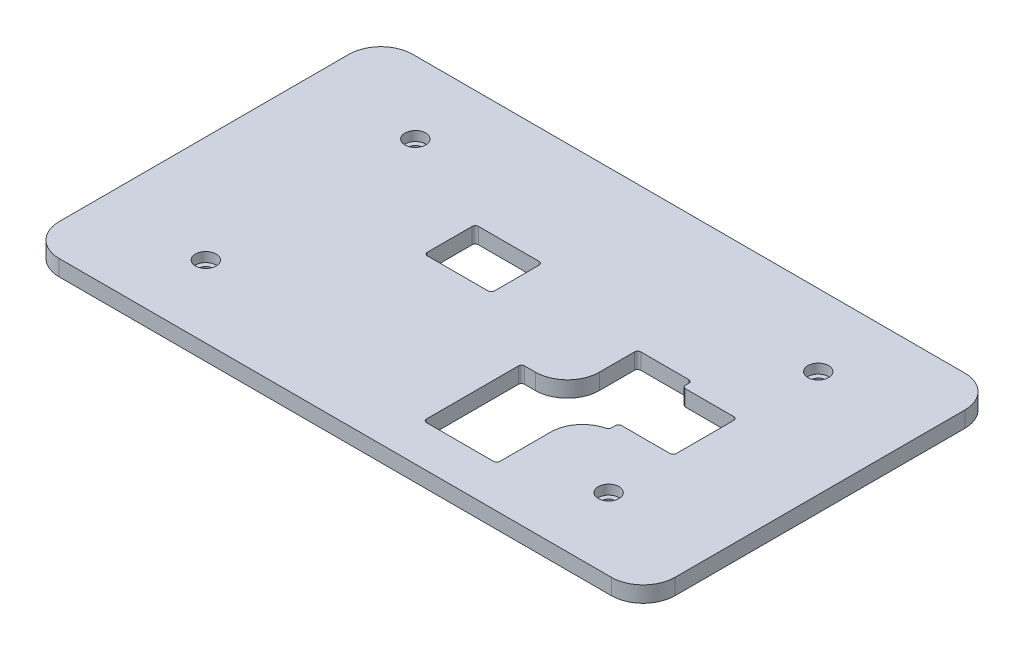
from build123d import *

# Parameters (mm, degrees)
SKETCH1_W                      = 192.96
SKETCH1_H                      = 110.76
BOSS_EXTRUDE1_DEPTH            = 5
CBORE_START                    = 2
CBORE_FOR_M3_SHCS1_OUTLINE_R   = 3.25
CBORE_FOR_M3_SHCS1_DEPTH       = 3
CBORE_FOR_M3_SHCS1_2_OUTLINE_R = 1.8
CBORE_FOR_M3_SHCS1_2_DEPTH     = 2
SKETCH9_W                      = 21
SKETCH9_H                      = 16
CUT_EXTRUDE1_DEPTH             = 112.356790543
FILLET1_R                      = 10
FILLET2_R                      = 10
FILLET3_R                      = 1


# Read off the part's stored shape, not the designer's step: CBORE for M3 SHCS1
with BuildPart() as part:
    # Sketch1 → Boss-Extrude1 (new body)
    with BuildSketch(Plane(origin=(0, 0, 0), x_dir=(1, 0, 0), z_dir=(0, 1, 0))):
        Rectangle(SKETCH1_W, SKETCH1_H)
    extrude(amount=BOSS_EXTRUDE1_DEPTH)

    # CBORE for M3 SHCS1 outline → CBORE for M3 SHCS1 (cut)
    with BuildSketch(Plane(origin=(0, 0, 0), x_dir=(1, 0, 0), z_dir=(0, 1, 0)).offset(CBORE_START)):
        with Locations((63.1, -32.825)):
            Circle(CBORE_FOR_M3_SHCS1_OUTLINE_R)
        with Locations((-63.1, 32.825)):
            Circle(CBORE_FOR_M3_SHCS1_OUTLINE_R)
        with Locations((-63.1, -32.825)):
            Circle(CBORE_FOR_M3_SHCS1_OUTLINE_R)
        with Locations((63.1, 32.825)):
            Circle(CBORE_FOR_M3_SHCS1_OUTLINE_R)
    extrude(amount=CBORE_FOR_M3_SHCS1_DEPTH, mode=Mode.SUBTRACT)

    # CBORE for M3 SHCS1 2 outline → CBORE for M3 SHCS1 2 (cut)
    with BuildSketch(Plane(origin=(0, 0, 0), x_dir=(1, 0, 0), z_dir=(0, 1, 0))):
        with Locations((63.1, -32.825)):
            Circle(CBORE_FOR_M3_SHCS1_2_OUTLINE_R)
        with Locations((-63.1, 32.825)):
            Circle(CBORE_FOR_M3_SHCS1_2_OUTLINE_R)
        with Locations((-63.1, -32.825)):
            Circle(CBORE_FOR_M3_SHCS1_2_OUTLINE_R)
        with Locations((63.1, 32.825)):
            Circle(CBORE_FOR_M3_SHCS1_2_OUTLINE_R)
    extrude(amount=CBORE_FOR_M3_SHCS1_2_DEPTH, mode=Mode.SUBTRACT)

    # Sketch9 → Cut-Extrude1 (cut, through all)
    with BuildSketch(Plane(origin=(0, 5, 0), x_dir=(1, 0, 0), z_dir=(0, 1, 0))):
        Polygon((45.98, 10.38), (28.98, 10.38), (28.98, -11.62), (14.6, -11.62), (14.6, -42.38), (37.6, -42.38), (37.6, -15.62), (45.98, -15.62), (45.98, -12.62), (63.1, -12.62), (63.1, 7.38), (45.98, 7.38), align=None)
        with Locations((-20, 11)):
            Rectangle(SKETCH9_W, SKETCH9_H)
    extrude(amount=-CUT_EXTRUDE1_DEPTH, mode=Mode.SUBTRACT)

    # Fillet1
    fillet1_edges = [part.edges().sort_by_distance(p)[0] for p in [
        (-96.48, 2.5, -55.38),
        (96.48, 2.5, -55.38),
        (96.48, 2.5, 55.38),
        (-96.48, 2.5, 55.38),
    ]]
    fillet(fillet1_edges, radius=FILLET1_R)

    # Fillet2
    # the kernel refuses this fillet: 10 mm, written as the material it takes off along each edge
    with BuildSketch(Plane(origin=(37.6, 29.669768949, 15.62), x_dir=(1, 0, 0), z_dir=(0, -1, 0))) as fillet2_piece_1:
        with BuildLine():
            CenterArc((10, 9.86790758), FILLET2_R, 180, 80.676997523)
            Line((0, 9.86790758), (-0.2, 9.86790758))
            Line((-0.2, 9.86790758), (-0.2, 0))
            Line((-0.2, 0), (0, -0.2))
            ThreePointArc((0, -0.2), (4.19, -0.2), (8.3476, -0.197358152))
            Line((8.3476, -0.197358152), (8.38, 0))
        make_face()
    extrude(amount=54.339537898, mode=Mode.SUBTRACT)
    with BuildSketch(Plane(origin=(28.98, 30, 11.62), x_dir=(-1, 0, 0), z_dir=(0, -1, 0))) as fillet2_piece_2:
        with BuildLine():
            CenterArc((FILLET2_R, FILLET2_R), FILLET2_R, 180, 90)
            Line((0, FILLET2_R), (-FILLET2_R * 0.02, FILLET2_R))
            Line((-FILLET2_R * 0.02, FILLET2_R), (-FILLET2_R * 0.02, -FILLET2_R * 0.02))
            Line((-FILLET2_R * 0.02, -FILLET2_R * 0.02), (FILLET2_R, -FILLET2_R * 0.02))
            Line((FILLET2_R, -FILLET2_R * 0.02), (FILLET2_R, 0))
        make_face()
    extrude(amount=55, mode=Mode.SUBTRACT)

    # Fillet3
    fillet3_edges = [part.edges().sort_by_distance(p)[0] for p in [
        (-30.5, 2.5, -3),
        (-30.5, 2.5, -19),
        (-9.5, 2.5, -19),
        (-9.5, 2.5, -3),
        (45.98, 2.5, -10.38),
        (45.98, 2.5, -7.38),
        (63.1, 2.5, -7.38),
        (63.1, 2.5, 12.62),
        (45.98, 2.5, 12.62),
        (45.98, 2.5, 15.62),
        (37.6, 2.5, 42.38),
        (14.6, 2.5, 42.38),
        (14.6, 2.5, 11.62),
        (28.98, 2.5, -10.38),
    ]]
    fillet(fillet3_edges, radius=FILLET3_R)


solid = part.part
